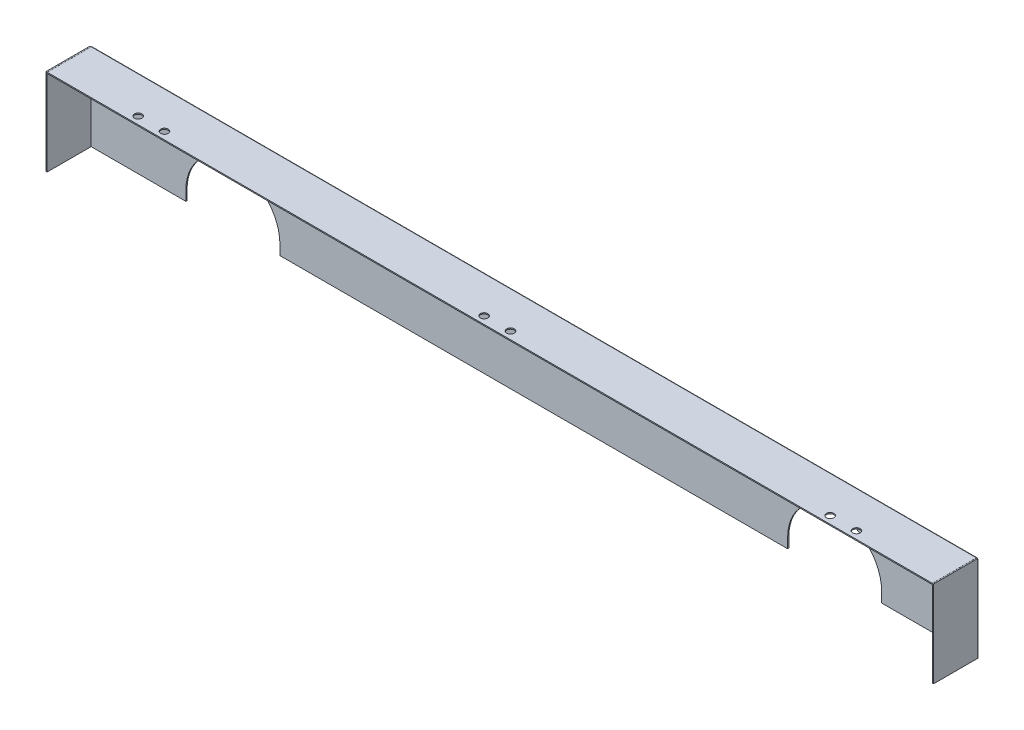
from build123d import *

# Parameters (mm, degrees)
SKETCH_1_R                         = 2.25
SM_BASE_FLANGE_1_DEPTH             = 1.5
SM_EDGE_FLANGE_1_STRIP_W           = 6.2
SM_EDGE_FLANGE_1_STRIP_H           = 1.5
SM_EDGE_FLANGE_1_STRIP_CUT_DEPTH   = 115
SM_EDGE_FLANGE_1_STRIP_2_W         = 6.2
SM_EDGE_FLANGE_1_STRIP_2_H         = 1.5
SM_EDGE_FLANGE_1_STRIP_CUT_2_DEPTH = 115
SM_EDGE_FLANGE_1_DEPTH             = 115
SM_EDGE_FLANGE_1_BEND_DEPTH        = 115
SM_START                           = 471.682547587
SM_EDGE_FLANGE_2_DEPTH             = 1180
SM_EDGE_FLANGE_2_2_DEPTH           = 1.6
SM_START_2                         = 1650.082547587
SM_EDGE_FLANGE_2_3_DEPTH           = 1.6
SM_START_3                         = 473.282547587
SM_EDGE_FLANGE_2_4_DEPTH           = 1176.8
SKETCH_15_R                        = 5
CUT_EXTRUDE_1_DEPTH                = 10


# Read off the part's stored shape, not the designer's step: 边线-法兰2
# Sheet-metal steps are written as plain solids
with BuildPart() as part:
    # Sketch 1 → 基体-法兰1 (new body)
    with BuildSketch(Plane.XY):
        with BuildLine():
            Line((471.682547587, -1331.896552128), (473.182547587, -1331.896552128))
            Line((473.182547587, -1331.896552128), (473.919147587, -1331.896552128))
            Line((473.919147587, -1331.896552128), (599.182547587, -1331.896552128))
            Line((599.182547587, -1331.896552128), (599.182547587, -1318.896552128))
            ThreePointArc((599.182547587, -1318.896552128), (661.682547587, -1256.396552128), (724.182547587, -1318.896552128))
            Line((724.182547587, -1318.896552128), (724.182547587, -1331.896552128))
            Line((724.182547587, -1331.896552128), (1399.182547587, -1331.896552128))
            Line((1399.182547587, -1331.896552128), (1399.182547587, -1318.896552128))
            ThreePointArc((1399.182547587, -1318.896552128), (1461.682547587, -1256.396552128), (1524.182547587, -1318.896552128))
            Line((1524.182547587, -1318.896552128), (1524.182547587, -1331.896552128))
            Line((1524.182547587, -1331.896552128), (1649.445947587, -1331.896552128))
            Line((1649.445947587, -1331.896552128), (1650.182547587, -1331.896552128))
            Line((1650.182547587, -1331.896552128), (1651.682547587, -1331.896552128))
            Line((1651.682547587, -1331.896552128), (1651.682547587, -1216.896552128))
            Line((1651.682547587, -1216.896552128), (471.682547587, -1216.896552128))
            Line((471.682547587, -1216.896552128), (471.682547587, -1331.896552128))
        make_face()
        with Locations((801.682547587, -1274.396552128)):
            Circle(SKETCH_1_R, mode=Mode.SUBTRACT)
        with Locations((1321.682547587, -1274.396552128)):
            Circle(SKETCH_1_R, mode=Mode.SUBTRACT)
        with Locations((506.682547587, -1274.396552128)):
            Circle(SKETCH_1_R, mode=Mode.SUBTRACT)
        with Locations((1061.682547587, -1274.396552128)):
            Circle(SKETCH_1_R, mode=Mode.SUBTRACT)
        with Locations((1616.682547587, -1274.396552128)):
            Circle(SKETCH_1_R, mode=Mode.SUBTRACT)
    extrude(amount=-SM_BASE_FLANGE_1_DEPTH)

    # 边线-法兰1 strip (across the edge) → 边线-法兰1 strip cut (cut)
    with BuildSketch(Plane(origin=(1651.682547587, -1331.896552128, 0), x_dir=(-1, 0, 0), z_dir=(0, 1, 0))):
        with Locations((-1.5, -0.75)):
            Rectangle(SM_EDGE_FLANGE_1_STRIP_W, SM_EDGE_FLANGE_1_STRIP_H)
    extrude(amount=SM_EDGE_FLANGE_1_STRIP_CUT_DEPTH, mode=Mode.SUBTRACT)

    # 边线-法兰1 strip 2 (across the edge) → 边线-法兰1 strip cut 2 (cut)
    with BuildSketch(Plane(origin=(471.682547587, -1216.896552128, 0), x_dir=(1, 0, 0), z_dir=(0, -1, 0))):
        with Locations((-1.5, -0.75)):
            Rectangle(SM_EDGE_FLANGE_1_STRIP_2_W, SM_EDGE_FLANGE_1_STRIP_2_H)
    extrude(amount=SM_EDGE_FLANGE_1_STRIP_CUT_2_DEPTH, mode=Mode.SUBTRACT)

    # 边线-法兰1 section (across the edge) → 边线-法兰1 (add)
    with BuildSketch(Plane(origin=(1651.682547587, -1331.896552128, 0), x_dir=(-1, 0, 0), z_dir=(0, 1, 0))):
        with BuildLine():
            Line((0, 0.1), (0, 58.5))
            Line((0, 58.5), (1.5, 58.5))
            Line((1.5, 58.5), (1.5, 0.1))
            ThreePointArc((1.5, 0.1), (1.529289322, 0.029289322), (1.6, 0))
            Line((1.6, 0), (1.6, -1.5))
            ThreePointArc((1.6, -1.5), (0.46862915, -1.03137085), (0, 0.1))
        make_face()
    extrude(amount=SM_EDGE_FLANGE_1_DEPTH)

    # 边线-法兰1 section 2 (across the edge) → 边线-法兰1 bend (add)
    with BuildSketch(Plane(origin=(471.682547587, -1216.896552128, 0), x_dir=(1, 0, 0), z_dir=(0, -1, 0))):
        with BuildLine():
            Line((0, 0.1), (0, 58.5))
            Line((0, 58.5), (1.5, 58.5))
            Line((1.5, 58.5), (1.5, 0.1))
            ThreePointArc((1.5, 0.1), (1.529289322, 0.029289322), (1.6, 0))
            Line((1.6, 0), (1.6, -1.5))
            ThreePointArc((1.6, -1.5), (0.46862915, -1.03137085), (0, 0.1))
        make_face()
    extrude(amount=SM_EDGE_FLANGE_1_BEND_DEPTH)

    # 边线-法兰2 outline → 边线-法兰2 (cut)
    with BuildSketch(Plane.YZ.offset(SM_START)):
        with BuildLine():
            Line((-1218.396552128, 0.1), (-1218.496552128, 0.1))
            Line((-1218.496552128, 0.1), (-1218.496552128, 0))
            ThreePointArc((-1218.496552128, 0), (-1218.42584145, 0.029289322), (-1218.396552128, 0.1))
        make_face()
        with BuildLine():
            ThreePointArc((-1216.896552128, 0.1), (-1217.365181278, -1.03137085), (-1218.496552128, -1.5))
            Line((-1218.496552128, -1.5), (-1216.896552128, -1.5))
            Line((-1216.896552128, -1.5), (-1216.896552128, 0.1))
        make_face()
    extrude(amount=SM_EDGE_FLANGE_2_DEPTH, mode=Mode.SUBTRACT)

    # Sm Edge Flange 2 2 outline → Sm Edge Flange 2 2 (cut)
    with BuildSketch(Plane.YZ.offset(SM_START)):
        with BuildLine():
            Line((-1216.896552128, 0.1), (-1218.396552128, 0.1))
            ThreePointArc((-1218.396552128, 0.1), (-1218.42584145, 0.029289322), (-1218.496552128, 0))
            Line((-1218.496552128, 0), (-1218.496552128, -1.5))
            ThreePointArc((-1218.496552128, -1.5), (-1217.365181278, -1.03137085), (-1216.896552128, 0.1))
        make_face()
    extrude(amount=SM_EDGE_FLANGE_2_2_DEPTH, mode=Mode.SUBTRACT)

    # Sm Edge Flange 2 3 outline → Sm Edge Flange 2 3 (cut)
    with BuildSketch(Plane.YZ.offset(SM_START_2)):
        with BuildLine():
            Line((-1216.896552128, 0.1), (-1218.396552128, 0.1))
            ThreePointArc((-1218.396552128, 0.1), (-1218.42584145, 0.029289322), (-1218.496552128, 0))
            Line((-1218.496552128, 0), (-1218.496552128, -1.5))
            ThreePointArc((-1218.496552128, -1.5), (-1217.365181278, -1.03137085), (-1216.896552128, 0.1))
        make_face()
    extrude(amount=SM_EDGE_FLANGE_2_3_DEPTH, mode=Mode.SUBTRACT)

    # Sm Edge Flange 2 4 outline → Sm Edge Flange 2 4 (add)
    with BuildSketch(Plane.YZ.offset(SM_START_3)):
        with BuildLine():
            Line((-1218.396552128, 58.5), (-1218.396552128, 0.1))
            ThreePointArc((-1218.396552128, 0.1), (-1218.42584145, 0.029289322), (-1218.496552128, 0))
            Line((-1218.496552128, 0), (-1216.899680186, 0))
            ThreePointArc((-1216.899680186, 0), (-1216.897334334, 0.049975544), (-1216.896552128, 0.1))
            Line((-1216.896552128, 0.1), (-1216.896552128, 58.5))
            Line((-1216.896552128, 58.5), (-1218.396552128, 58.5))
        make_face()
    extrude(amount=SM_EDGE_FLANGE_2_4_DEPTH)

    # 草图15 → 切除-拉伸1 (cut)
    with BuildSketch(Plane(origin=(0, -1216.896552128, 0), x_dir=(1, 0, 0), z_dir=(0, 1, 0))):
        with Locations(Location((619.182547587, -48.5, 0), (0, 0, 270))):
            Circle(SKETCH_15_R)
        with Locations(Location((584.182547587, -48.5, 0), (0, 0, 270))):
            Circle(SKETCH_15_R)
        with Locations(Location((1079.182547587, -48.5, 0), (0, 0, 270))):
            Circle(SKETCH_15_R)
        with Locations(Location((1044.182547587, -48.5, 0), (0, 0, 270))):
            Circle(SKETCH_15_R)
        with Locations(Location((1504.182547587, -48.5, 0), (0, 0, 270))):
            Circle(SKETCH_15_R)
        with Locations(Location((1539.182547587, -48.5, 0), (0, 0, 270))):
            Circle(SKETCH_15_R)
    extrude(amount=-CUT_EXTRUDE_1_DEPTH, mode=Mode.SUBTRACT)


solid = part.part
